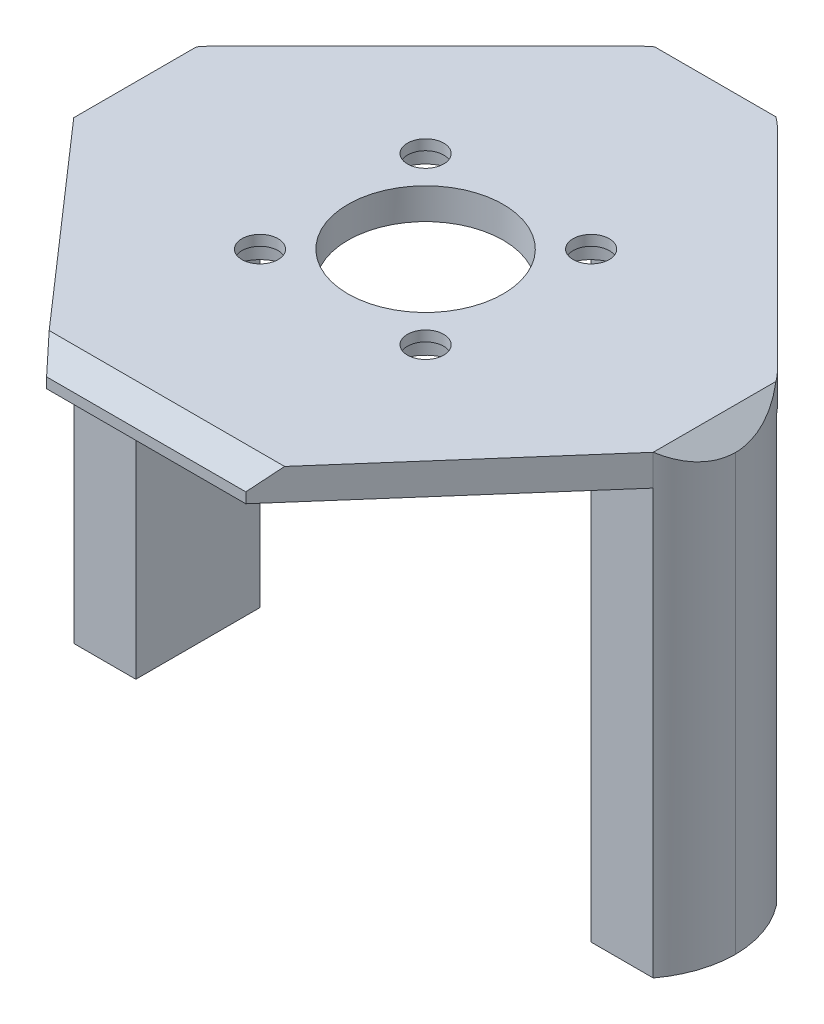
from build123d import *
from build123d.topology import SkipClean

# Parameters (mm, degrees)
SKETCH1_W           = 60
SKETCH1_H           = 60
BOSS_EXTRUDE1_DEPTH = 3
SKETCH4_W           = 8
SKETCH4_H           = 12
SKETCH4_W_2         = 12
SKETCH4_H_2         = 8
BOSS_EXTRUDE3_DEPTH = 41
SKETCH5_R           = 2
CUT_EXTRUDE2_DEPTH  = 6
SKETCH8_R           = 7.5
CUT_EXTRUDE4_DEPTH  = 6
CUT_EXTRUDE5_DEPTH  = 6
CUT_EXTRUDE6_DEPTH  = 6
SKETCH11_W          = 23.25
SKETCH11_H          = 3
CUT_EXTRUDE7_DEPTH  = 6
SKETCH12_R          = 3
CUT_EXTRUDE8_DEPTH  = 2
SKETCH13_R          = 1.75
CUT_EXTRUDE9_DEPTH  = 1
CHAMFER1_SIZE       = 2
CHAMFER2_SIZE       = 2
CHAMFER3_SIZE       = 2
CUT_EXTRUDE10_DEPTH = 10
FILLET1_R           = 10
CUT_EXTRUDE11_DEPTH = 59.999486357


with BuildPart() as part:
    # Sketch1 → Boss-Extrude1 (new body)
    with BuildSketch(Plane(origin=(0, 0, 0), x_dir=(1, 0, 0), z_dir=(0, 1, 0))):
        Rectangle(SKETCH1_W, SKETCH1_H)
    extrude(amount=BOSS_EXTRUDE1_DEPTH)

    # Sketch4 → Boss-Extrude3 (add)
    with BuildSketch(Plane.XZ):
        with Locations((-26, 0)):
            Rectangle(SKETCH4_W, SKETCH4_H)
        with Locations((0, -26)):
            Rectangle(SKETCH4_W_2, SKETCH4_H_2)
        with Locations((26, 0)):
            Rectangle(SKETCH4_W, SKETCH4_H)
    extrude(amount=BOSS_EXTRUDE3_DEPTH)

    # Sketch5 → Cut-Extrude2 (cut)
    with BuildSketch(Plane.XZ.offset(41)):
        with Locations(Location((0, -26.5, 0), (0, 0, 270))):
            Circle(SKETCH5_R)
        with Locations(Location((-26.5, 0, 0), (0, 0, 270))):
            Circle(SKETCH5_R)
        with Locations(Location((26.5, 0, 0), (0, 0, 270))):
            Circle(SKETCH5_R)
    extrude(amount=-CUT_EXTRUDE2_DEPTH, mode=Mode.SUBTRACT)

    # Sketch8 → Cut-Extrude4 (cut)
    with BuildSketch(Plane(origin=(0, 3, 0), x_dir=(1, 0, 0), z_dir=(0, 1, 0))):
        with Locations(Location((0, 0, 0), (0, 0, 270))):
            Circle(SKETCH8_R)
    extrude(amount=-CUT_EXTRUDE4_DEPTH, mode=Mode.SUBTRACT)

    # Sketch7 → Cut-Extrude5 (cut)
    with BuildSketch(Plane.XZ):
        Polygon((-30, -6), (-6, -30), (-30, -30), align=None)
        Polygon((30, -6), (6, -30), (30, -30), align=None)
    extrude(amount=-CUT_EXTRUDE5_DEPTH, mode=Mode.SUBTRACT)

    # Sketch10 → Cut-Extrude6 (cut)
    with BuildSketch(Plane.XZ):
        Polygon((-9, 30), (-30, 6), (-30, 30), align=None)
        Polygon((9, 30), (30, 6), (30, 30), align=None)
    extrude(amount=-CUT_EXTRUDE6_DEPTH, mode=Mode.SUBTRACT)

    # Sketch11 → Cut-Extrude7 (cut)
    with BuildSketch(Plane.XZ):
        with Locations((0, 28.5)):
            Rectangle(SKETCH11_W, SKETCH11_H)
    extrude(amount=-CUT_EXTRUDE7_DEPTH, mode=Mode.SUBTRACT)

    # Sketch12 → Cut-Extrude8 (cut)
    with BuildSketch(Plane.XZ):
        with Locations(Location((-8, 8, 0), (0, 0, 270))):
            Circle(SKETCH12_R)
        with Locations(Location((8, 8, 0), (0, 0, 270))):
            Circle(SKETCH12_R)
        with Locations(Location((8, -8, 0), (0, 0, 270))):
            Circle(SKETCH12_R)
        with Locations(Location((-8, -8, 0), (0, 0, 270))):
            Circle(SKETCH12_R)
    extrude(amount=-CUT_EXTRUDE8_DEPTH, mode=Mode.SUBTRACT)

    # Sketch13 → Cut-Extrude9 (cut)
    with BuildSketch(Plane(origin=(0, 3, 0), x_dir=(1, 0, 0), z_dir=(0, 1, 0))):
        with Locations(Location((-8, 8, 0), (0, 0, 270))):
            Circle(SKETCH13_R)
        with Locations(Location((8, 8, 0), (0, 0, 270))):
            Circle(SKETCH13_R)
        with Locations(Location((8, -8, 0), (0, 0, 270))):
            Circle(SKETCH13_R)
        with Locations(Location((-8, -8, 0), (0, 0, 270))):
            Circle(SKETCH13_R)
    extrude(amount=-CUT_EXTRUDE9_DEPTH, mode=Mode.SUBTRACT)

    # Chamfer1
    chamfer1_edges = [part.edges().sort_by_distance(p)[0] for p in [
        (30, 3, 0),
        (0, 3, -30),
        (-30, 3, 0),
    ]]
    chamfer(chamfer1_edges, length=CHAMFER1_SIZE)

    # Chamfer2
    chamfer2_edges = [part.edges().sort_by_distance(p)[0] for p in [
        (0, 3, 27),
    ]]
    chamfer(chamfer2_edges, length=CHAMFER2_SIZE)

    # Chamfer3
    chamfer3_edges = [part.edges().sort_by_distance(p)[0] for p in [
        (6, -20.5, -30),
        (-6, -20.5, -30),
        (-30, -20.5, -6),
        (-30, -20.5, 6),
        (30, -20.5, 6),
        (30, -20.5, -6),
    ]]
    chamfer(chamfer3_edges, length=CHAMFER3_SIZE)

    # Sketch14 → Cut-Extrude10 (cut)
    with BuildSketch(Plane.XZ):
        Polygon((-30, -4), (-4, -30), (-6, -30), (-30, -6), align=None)
        Polygon((4, -30), (30, -4), (30, -6), (6, -30), align=None)
    extrude(amount=-CUT_EXTRUDE10_DEPTH, mode=Mode.SUBTRACT)

    # Fillet1
    # the kernel refuses this fillet: 10 mm, written as the material it takes off along each edge
    with BuildSketch(Plane(origin=(-4, 11.355339059, -30), x_dir=(1, 0, 0), z_dir=(0, -1, 0)), Plane(origin=(4, -51.355339059, -30), x_dir=(-1, 0, 0), z_dir=(0, 1, 0)), Plane(origin=(30, 11.355339059, -4), x_dir=(0, 0, 1), z_dir=(0, -1, 0))) as fillet1_piece_1:
        with BuildLine():
            CenterArc((FILLET1_R * 0.414213562373, FILLET1_R), FILLET1_R, 225, 45)
            Line((-FILLET1_R * 0.292893218813, FILLET1_R * 0.292893218813), (0, 0))
            Line((0, 0), (FILLET1_R * 0.414213562373, 0))
        make_face()
    extrude(amount=62.710678119, mode=Mode.SUBTRACT)
    with BuildSketch(Plane(origin=(-30, 0, 4), x_dir=(0, 0, -1), z_dir=(0, -1, 0))) as fillet1_piece_2:
        with BuildLine():
            CenterArc((4, 10), FILLET1_R, 233.130102354, 36.869897646)
            Line((-2, 2), (0, 0))
            Line((0, 0), (4, 0))
        make_face()
    extrude(amount=51, mode=Mode.SUBTRACT)
    with BuildSketch(Plane(origin=(-30, 11.355339059, -4), x_dir=(0, 0, 1), z_dir=(0, -1, 0))) as fillet1_piece_3:
        with BuildLine():
            CenterArc((FILLET1_R * 0.414213562373, -FILLET1_R), FILLET1_R, 90, 45)
            Line((-FILLET1_R * 0.292893218813, -FILLET1_R * 0.292893218813), (0, 0))
            Line((0, 0), (FILLET1_R * 0.414213562373, 0))
        make_face()
    extrude(amount=62.710678119, mode=Mode.SUBTRACT)
    with BuildSketch(Plane(origin=(30, 0, 4), x_dir=(0, 0, -1), z_dir=(0, -1, 0))) as fillet1_piece_4:
        with BuildLine():
            CenterArc((4, -10), FILLET1_R, 90, 36.869897646)
            Line((-2, -2), (0, 0))
            Line((0, 0), (4, 0))
        make_face()
    extrude(amount=51, mode=Mode.SUBTRACT)

    # Sketch16 → Cut-Extrude11 (cut, through all)
    with SkipClean():  # the faces are left unmerged after this step: merging them gives an invalid solid
        with BuildSketch(Plane.XZ):
            with BuildLine():
                Line((-28, 6), (-9.625, 27))
                Line((-9.625, 27), (-11.625, 27))
                Line((-11.625, 27), (-30, 6))
                Line((-30, 6), (-30, 0.142135624))
                ThreePointArc((-30, 0.142135624), (-29.999936866, 0.106601493), (-29.999747465, 0.071067812))
                ThreePointArc((-29.999747465, 0.071067812), (-29.475536208, 3.195968331), (-28, 6))
            make_face()
            with BuildLine():
                Line((28, 6), (9.625, 27))
                Line((9.625, 27), (11.625, 27))
                Line((11.625, 27), (30, 6))
                Line((30, 6), (30, 0.142135624))
                ThreePointArc((30, 0.142135624), (29.999936866, 0.106601493), (29.999747465, 0.071067812))
                ThreePointArc((29.999747465, 0.071067812), (29.475536208, 3.195968331), (28, 6))
            make_face()
        extrude(amount=-CUT_EXTRUDE11_DEPTH, mode=Mode.SUBTRACT)


solid = part.part
